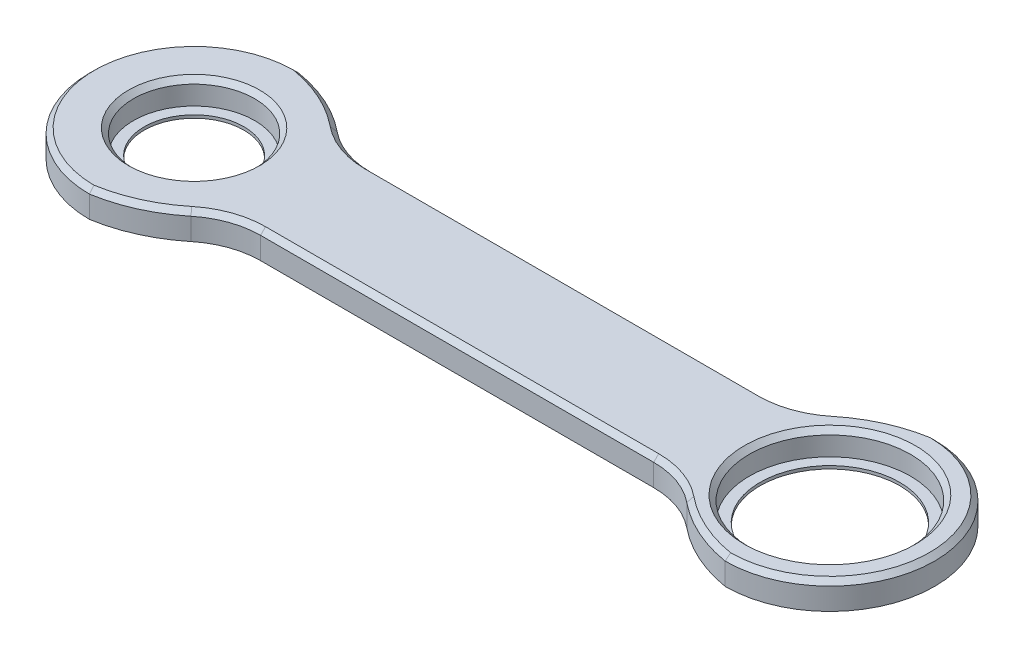
from build123d import *

# Parameters (mm, degrees)
SKETCH1_R           = 12.15
SKETCH1_R_2         = 16.15
BOSS_EXTRUDE1_DEPTH = 5.4
FILLET1_R           = 30
CHAMFER1_SIZE       = 1
SKETCH2_R           = 14.75534968
SKETCH2_R_2         = 10
SKETCH2_R_3         = 19.025242353
SKETCH2_R_4         = 14
BOSS_EXTRUDE2_DEPTH = 0.6


with BuildPart() as part:
    # Sketch1 → Boss-Extrude1 (new body)
    with BuildSketch(Plane(origin=(0, 0, 0), x_dir=(1, 0, 0), z_dir=(0, 1, 0))):
        with BuildLine():
            Line((54.45294862, -21), (63.75, -21))
            ThreePointArc((63.75, -21), (84.75, 0), (63.75, 21))
            Line((63.75, 21), (54.45294862, 21))
            ThreePointArc((54.45294862, 21), (48.447855306, 13.72835863), (39.420454068, 11))
            Line((39.420454068, 11), (-39.420454068, 11))
            ThreePointArc((-39.420454068, 11), (-48.447855306, 13.72835863), (-54.45294862, 21))
            Line((-54.45294862, 21), (-63.75, 21))
            ThreePointArc((-63.75, 21), (-84.75, 0), (-63.75, -21))
            Line((-63.75, -21), (-54.45294862, -21))
            ThreePointArc((-54.45294862, -21), (-48.447855306, -13.72835863), (-39.420454068, -11))
            Line((-39.420454068, -11), (39.420454068, -11))
            ThreePointArc((39.420454068, -11), (48.447855306, -13.72835863), (54.45294862, -21))
        make_face()
        with Locations(Location((-63.75, 0, 0), (0, 0, 90))):
            Circle(SKETCH1_R, mode=Mode.SUBTRACT)
        with Locations(Location((63.75, 0, 0), (0, 0, 90))):
            Circle(SKETCH1_R_2, mode=Mode.SUBTRACT)
    extrude(amount=BOSS_EXTRUDE1_DEPTH)

    # Fillet1
    # the kernel refuses this fillet: 30 mm, written as the material it takes off along each edge
    with BuildSketch(Plane(origin=(-54.45294862, -23.24262845, -21), x_dir=(0.5987620470660618, 0, 0.8009269698251266), z_dir=(0, 1, 0))) as fillet1_piece_1:
        with BuildLine():
            CenterArc((15.193568911, -29.102905777), FILLET1_R, 104.047021464, 29.74238235)
            Line((-5.566721516, -7.44625919), (-5.981927325, -7.013126259))
            ThreePointArc((-5.981927325, -7.013126259), (-3.26391694, -3.363872367), (-0.480556182, 0.359257228))
            Line((-0.480556182, 0.359257228), (0.145630869, 0.582058116))
            ThreePointArc((0.145630869, 0.582058116), (3.95601272, 0.11261485), (7.76639457, 0.582058116))
            Line((7.76639457, 0.582058116), (7.912025439, 0))
        make_face()
    extrude(amount=51.885256901, mode=Mode.SUBTRACT)
    with BuildSketch(Plane(origin=(54.45294862, -23.24262845, -21), x_dir=(1, 0, 0), z_dir=(0, 1, 0)), Plane(origin=(-54.45294862, -23.24262845, 21), x_dir=(-1, 0, 0), z_dir=(0, 1, 0))) as fillet1_piece_2:
        with BuildLine():
            CenterArc((14.211969714, -29.594654547), FILLET1_R, 99.429309033, 29.74238235)
            Line((-4.737420548, -6.33695456), (-5.116408354, -5.87180056))
            ThreePointArc((-5.116408354, -5.87180056), (-2.458906545, -3.101047782), (-0.55338428, 0.231874618))
            Line((-0.55338428, 0.231874618), (0, 0.6))
            ThreePointArc((0, 0.6), (4.64852569, 0.6), (9.198753014, 0.591893091))
            Line((9.198753014, 0.591893091), (9.29705138, 0))
        make_face()
    extrude(amount=51.885256901, mode=Mode.SUBTRACT)
    with BuildSketch(Plane(origin=(54.45294862, -23.24262845, 21), x_dir=(1, 0, 0), z_dir=(0, 1, 0))) as fillet1_piece_3:
        with BuildLine():
            CenterArc((14.211969714, 29.594654547), FILLET1_R, 230.828308617, 29.74238235)
            Line((-4.737420548, 6.33695456), (-5.116408354, 5.87180056))
            ThreePointArc((-5.116408354, 5.87180056), (-2.458906545, 3.101047782), (-0.55338428, -0.231874618))
            Line((-0.55338428, -0.231874618), (0, -0.6))
            ThreePointArc((0, -0.6), (4.64852569, -0.6), (9.198753014, -0.591893091))
            Line((9.198753014, -0.591893091), (9.29705138, 0))
        make_face()
    extrude(amount=51.885256901, mode=Mode.SUBTRACT)

    # Chamfer1
    # the kernel refuses this chamfer: 1 mm, written as the material it takes off along each edge
    with BuildSketch(Plane(origin=(63.75, 5.4, 0), x_dir=(-0.12235070165055995, 0, 0.9924869297908239), z_dir=(-0.9924869297908239, 0, -0.12235070165055995))) as chamfer1_piece_1:
        Polygon((21, -CHAMFER1_SIZE), (21 - CHAMFER1_SIZE, 0), (21, 0), align=None)
    revolve(axis=Axis((63.75, 5.4, 0), (0, 1, 0)), revolution_arc=194.055575488, mode=Mode.SUBTRACT)
    with BuildSketch(Plane(origin=(39.420454068, 5.4, -27.298794623), x_dir=(0.6316463420707552, 0, 0.7752566662394039), z_dir=(0.7752566662394039, 0, -0.6316463420707552))) as chamfer1_piece_2:
        Polygon((16.298794623 + CHAMFER1_SIZE, 0), (16.298794623, CHAMFER1_SIZE), (16.298794623, 0), align=None)
    revolve(axis=Axis((39.420454068, 5.4, -27.298794623), (0, -1, 0)), revolution_arc=39.171691383, mode=Mode.SUBTRACT)
    with BuildSketch(Plane(origin=(39.420454068, 5.4, -11), x_dir=(0, 0, 1), z_dir=(-1, 0, 0)), Plane(origin=(-39.420454068, 5.4, 11), x_dir=(0, 0, -1), z_dir=(1, 0, 0))) as chamfer1_piece_3:
        Polygon((CHAMFER1_SIZE, 0), (0, -CHAMFER1_SIZE), (0, 0), align=None)
    extrude(amount=78.840908135, mode=Mode.SUBTRACT)
    with BuildSketch(Plane(origin=(-39.420454068, 5.4, -27.298794623), x_dir=(0, 0, 1), z_dir=(1, 0, 0))) as chamfer1_piece_4:
        Polygon((16.298794623 + CHAMFER1_SIZE, 0), (16.298794623, CHAMFER1_SIZE), (16.298794623, 0), align=None)
    revolve(axis=Axis((-39.420454068, 5.4, -27.298794623), (0, -1, 0)), revolution_arc=39.171691383, mode=Mode.SUBTRACT)
    with BuildSketch(Plane(origin=(39.420454068, 5.4, 27.298794623), x_dir=(0, 0, -1), z_dir=(-1, 0, 0))) as chamfer1_piece_5:
        Polygon((16.298794623 + CHAMFER1_SIZE, 0), (16.298794623, CHAMFER1_SIZE), (16.298794623, 0), align=None)
    revolve(axis=Axis((39.420454068, 5.4, 27.298794623), (0, -1, 0)), revolution_arc=39.171691383, mode=Mode.SUBTRACT)
    with BuildSketch(Plane(origin=(-68.664918334, 5.4, -8.594654547), x_dir=(0.6316463420707823, 0, 0.7752566662393817), z_dir=(0.7752566662393817, 0, -0.6316463420707823))) as chamfer1_piece_6:
        Polygon((30 - CHAMFER1_SIZE, 0), (30, CHAMFER1_SIZE), (30, 0), align=None)
    revolve(axis=Axis((-68.664918334, 5.4, -8.594654547), (0, -1, 0)), revolution_arc=44.477686757, mode=Mode.SUBTRACT)
    with BuildSketch(Plane(origin=(68.664918334, 5.4, -8.594654547), x_dir=(0.09247477859233537, 0, 0.9957150271660554), z_dir=(0.9957150271660554, 0, -0.09247477859233537))) as chamfer1_piece_7:
        Polygon((30, CHAMFER1_SIZE), (30 - CHAMFER1_SIZE, 0), (30, 0), align=None)
    revolve(axis=Axis((68.664918334, 5.4, -8.594654547), (0, -1, 0)), revolution_arc=44.477686757, mode=Mode.SUBTRACT)
    with BuildSketch(Plane(origin=(68.664918334, 5.4, 8.594654547), x_dir=(-0.6316463420707823, 0, -0.7752566662393817), z_dir=(-0.7752566662393817, 0, 0.6316463420707823))) as chamfer1_piece_8:
        Polygon((30, CHAMFER1_SIZE), (30 - CHAMFER1_SIZE, 0), (30, 0), align=None)
    revolve(axis=Axis((68.664918334, 5.4, 8.594654547), (0, -1, 0)), revolution_arc=44.477686757, mode=Mode.SUBTRACT)
    with BuildSketch(Plane(origin=(-68.664918334, 5.4, 8.594654547), x_dir=(-0.09247477859236329, 0, -0.9957150271660529), z_dir=(-0.9957150271660529, 0, 0.09247477859236329))) as chamfer1_piece_9:
        Polygon((30 - CHAMFER1_SIZE, 0), (30, CHAMFER1_SIZE), (30, 0), align=None)
    revolve(axis=Axis((-68.664918334, 5.4, 8.594654547), (0, -1, 0)), revolution_arc=44.477686757, mode=Mode.SUBTRACT)
    with BuildSketch(Plane(origin=(-63.75, 5.4, 0), x_dir=(0.12235070165055861, 0, -0.992486929790824), z_dir=(0.992486929790824, 0, 0.12235070165055861))) as chamfer1_piece_10:
        Polygon((21 - CHAMFER1_SIZE, 0), (21, -CHAMFER1_SIZE), (21, 0), align=None)
    revolve(axis=Axis((-63.75, 5.4, 0), (0, 1, 0)), revolution_arc=194.055575488, mode=Mode.SUBTRACT)
    with BuildSketch(Plane(origin=(-39.420454068, 5.4, 27.298794623), x_dir=(-0.6316463420707533, 0, -0.7752566662394053), z_dir=(-0.7752566662394053, 0, 0.6316463420707533))) as chamfer1_piece_11:
        Polygon((16.298794623 + CHAMFER1_SIZE, 0), (16.298794623, CHAMFER1_SIZE), (16.298794623, 0), align=None)
    revolve(axis=Axis((-39.420454068, 5.4, 27.298794623), (0, -1, 0)), revolution_arc=39.171691383, mode=Mode.SUBTRACT)
    with BuildSketch(Plane(origin=(-63.75, 5.4, 0), x_dir=(0, 0, -1), z_dir=(1, 0, 0))) as chamfer1_piece_12:
        Polygon((12.15 + CHAMFER1_SIZE, 0), (12.15, -CHAMFER1_SIZE), (12.15, 0), align=None)
    revolve(axis=Axis((-63.75, 5.4, 0), (0, 1, 0)), mode=Mode.SUBTRACT)
    with BuildSketch(Plane(origin=(63.75, 5.4, 0), x_dir=(0, 0, -1), z_dir=(1, 0, 0))) as chamfer1_piece_13:
        Polygon((16.15 + CHAMFER1_SIZE, 0), (16.15, -CHAMFER1_SIZE), (16.15, 0), align=None)
    revolve(axis=Axis((63.75, 5.4, 0), (0, 1, 0)), mode=Mode.SUBTRACT)

    # Sketch2 → Boss-Extrude2 (add)
    # profile 1 of 2: a face of its own
    with BuildSketch(Plane.XZ):
        with Locations((-63.75, 0)):
            Circle(SKETCH2_R)
        with Locations(Location((-63.75, 0, 0), (0, 0, 270))):
            Circle(SKETCH2_R_2, mode=Mode.SUBTRACT)
    # profile 2 of 2: a face of its own
    with BuildSketch(Plane.XZ):
        with Locations((63.75, 0)):
            Circle(SKETCH2_R_3)
        with Locations(Location((63.75, 0, 0), (0, 0, 270))):
            Circle(SKETCH2_R_4, mode=Mode.SUBTRACT)
    extrude(amount=-BOSS_EXTRUDE2_DEPTH)


solid = part.part
